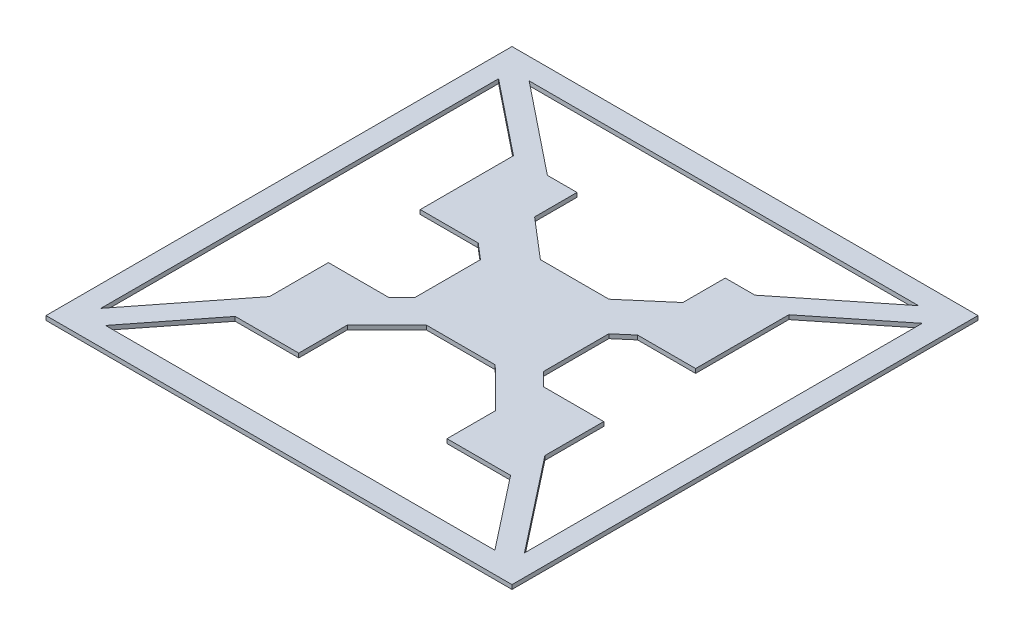
from build123d import *

# Parameters (mm, degrees)
SKETCH_1_W      = 220
SKETCH_1_H      = 220
EXTRUDE_1_DEPTH = 2


with BuildPart() as part:
    # Эскиз1 → Бобышка-Вытянуть1 (new body)
    with BuildSketch(Plane(origin=(0, 0, 0), x_dir=(1, 0, 0), z_dir=(0, 1, 0))):
        Rectangle(SKETCH_1_W, SKETCH_1_H)
        Polygon((-48.986556615, 65.681331463), (-35, 65.681331463), (-35, 45.670187564), (-16.186181138, 29.577047454), (16.186181138, 29.577047454), (35, 45.670187564), (35, 65.681331463), (48.986556615, 65.681331463), (91.909645298, 100), (-91.909645298, 100), align=None, mode=Mode.SUBTRACT)
        Polygon((-65, -21.681331463), (-36.641715547, -21.681331463), (-30.298387647, -15.412142568), (-30.298387647, 15.412142568), (-37.627434901, 21.681331463), (-65, 21.681331463), (-65, 65.681331463), (-100, 93.665184331), (-100, -94.111494816), (-65, -49.474957046), align=None, mode=Mode.SUBTRACT)
        Polygon((-35, -65.681331463), (-65, -65.681331463), (-91.909645298, -100), (91.909645298, -100), (65, -65.681331463), (35, -65.681331463), (35, -42.700820991), (16.186181138, -24.10689267), (-16.186181138, -24.10689267), (-35, -42.700820991), align=None, mode=Mode.SUBTRACT)
        Polygon((36.641715547, -21.681331463), (65, -21.681331463), (65, -49.474957046), (100, -94.111494816), (100, 93.665184331), (65, 65.681331463), (65, 21.681331463), (37.627434901, 21.681331463), (30.298387647, 15.412142568), (30.298387647, -15.412142568), align=None, mode=Mode.SUBTRACT)
    extrude(amount=EXTRUDE_1_DEPTH)


solid = part.part
